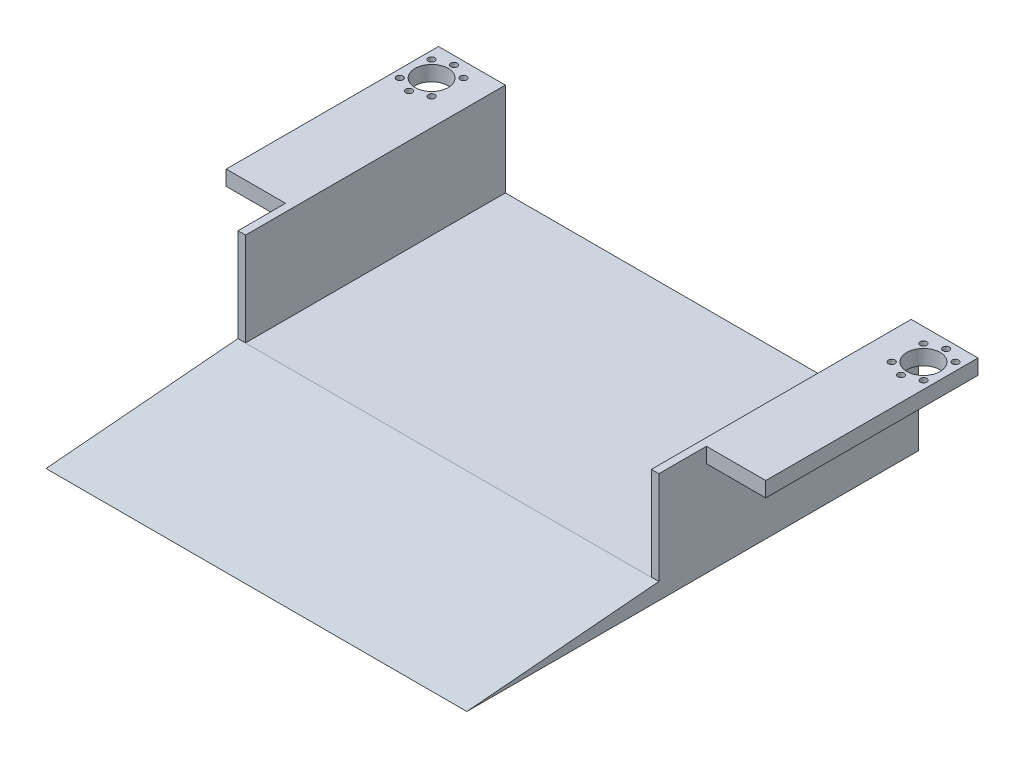
from build123d import *

# Parameters (mm, degrees)
SKETCH1_W           = 454.914
SKETCH1_H           = 381
BOSS_EXTRUDE1_DEPTH = 92.6973
SKETCH3_W           = 50.0126
SKETCH3_H           = 202.0062
CUT_EXTRUDE1_DEPTH  = 601.583496962
SKETCH4_R           = 14
CUT_EXTRUDE2_DEPTH  = 601.583496962
SKETCH5_W           = 342.1888
SKETCH5_H           = 381
CUT_EXTRUDE3_DEPTH  = 78.74
SKETCH6_W           = 178.9938
SKETCH6_H           = 79.9974
CUT_EXTRUDE4_DEPTH  = 50.0126
SKETCH7_W           = 178.9938
SKETCH7_H           = 79.9974
CUT_EXTRUDE5_DEPTH  = 50.0126
CUT_EXTRUDE6_DEPTH  = 564.647880462
SKETCH11_R          = 2.7499945
SKETCH11_R_2        = 2.75
CUT_EXTRUDE7_DEPTH  = 601.583496962
SKETCH12_R          = 2.75
CUT_EXTRUDE8_DEPTH  = 601.583496962


with BuildPart() as part:
    # Sketch1 → Boss-Extrude1 (new body)
    with BuildSketch(Plane(origin=(0, 0, 0), x_dir=(1, 0, 0), z_dir=(0, 1, 0))):
        with Locations((227.457, 190.5)):
            Rectangle(SKETCH1_W, SKETCH1_H)
    extrude(amount=BOSS_EXTRUDE1_DEPTH)

    # Sketch3 → Cut-Extrude1 (cut, through all)
    with BuildSketch(Plane(origin=(0, 92.6973, 0), x_dir=(1, 0, 0), z_dir=(0, 1, 0))):
        with Locations((429.9077, 101.0031)):
            Rectangle(SKETCH3_W, SKETCH3_H)
        with Locations((25.0063, 101.0031)):
            Rectangle(SKETCH3_W, SKETCH3_H)
    extrude(amount=-CUT_EXTRUDE1_DEPTH, mode=Mode.SUBTRACT)

    # Sketch4 → Cut-Extrude2 (cut, through all)
    with BuildSketch(Plane(origin=(0, 92.6973, 0), x_dir=(1, 0, 0), z_dir=(0, 1, 0))):
        with Locations((20.066, 355.092)):
            Circle(SKETCH4_R)
        with Locations((434.848, 355.092)):
            Circle(SKETCH4_R)
    extrude(amount=-CUT_EXTRUDE2_DEPTH, mode=Mode.SUBTRACT)

    # Sketch5 → Cut-Extrude3 (cut)
    with BuildSketch(Plane(origin=(0, 92.6973, 0), x_dir=(1, 0, 0), z_dir=(0, 1, 0))):
        with Locations((227.457, 190.5)):
            Rectangle(SKETCH5_W, SKETCH5_H)
    extrude(amount=-CUT_EXTRUDE3_DEPTH, mode=Mode.SUBTRACT)

    # Sketch6 → Cut-Extrude4 (cut)
    with BuildSketch(Plane(origin=(454.914, 0, 0), x_dir=(0, 0, -1), z_dir=(1, 0, 0))):
        with Locations((291.5031, 39.9987)):
            Rectangle(SKETCH6_W, SKETCH6_H)
    extrude(amount=-CUT_EXTRUDE4_DEPTH, mode=Mode.SUBTRACT)

    # Sketch7 → Cut-Extrude5 (cut)
    with BuildSketch(Plane.ZY):
        with Locations((-291.5031, 39.9987)):
            Rectangle(SKETCH7_W, SKETCH7_H)
    extrude(amount=-CUT_EXTRUDE5_DEPTH, mode=Mode.SUBTRACT)

    # Sketch10 → Cut-Extrude6 (cut, through all)
    with BuildSketch(Plane(origin=(404.9014, 0, 0), x_dir=(0, 0, -1), z_dir=(1, 0, 0))):
        Polygon((0, 0), (161.899498709, 13.97), (161.899498709, 92.6973), (0, 92.6973), align=None)
    extrude(amount=-CUT_EXTRUDE6_DEPTH, mode=Mode.SUBTRACT)

    # Sketch11 → Cut-Extrude7 (cut, through all)
    with BuildSketch(Plane(origin=(0, 92.6973, 0), x_dir=(1, 0, 0), z_dir=(0, 1, 0))):
        with Locations((434.848, 374.174211985)):
            Circle(SKETCH11_R)
        with Locations((448.283028843, 368.609240827)):
            Circle(SKETCH11_R_2)
        with Locations((421.412971157, 368.609240827)):
            Circle(SKETCH11_R_2)
        with Locations((448.283028843, 341.739183142)):
            Circle(SKETCH11_R_2)
        with Locations((434.848, 336.174211985)):
            Circle(SKETCH11_R_2)
        with Locations((421.412971157, 341.739183142)):
            Circle(SKETCH11_R_2)
    extrude(amount=-CUT_EXTRUDE7_DEPTH, mode=Mode.SUBTRACT)

    # Sketch12 → Cut-Extrude8 (cut, through all)
    with BuildSketch(Plane(origin=(0, 92.6973, 0), x_dir=(1, 0, 0), z_dir=(0, 1, 0))):
        with Locations((20.066, 374.092)):
            Circle(SKETCH12_R)
        with Locations((6.630971157, 368.527028843)):
            Circle(SKETCH12_R)
        with Locations((33.501028843, 368.527028843)):
            Circle(SKETCH12_R)
        with Locations((33.501028843, 341.656971157)):
            Circle(SKETCH12_R)
        with Locations((20.066, 336.092)):
            Circle(SKETCH12_R)
        with Locations((6.630971157, 341.656971157)):
            Circle(SKETCH12_R)
    extrude(amount=-CUT_EXTRUDE8_DEPTH, mode=Mode.SUBTRACT)


solid = part.part
